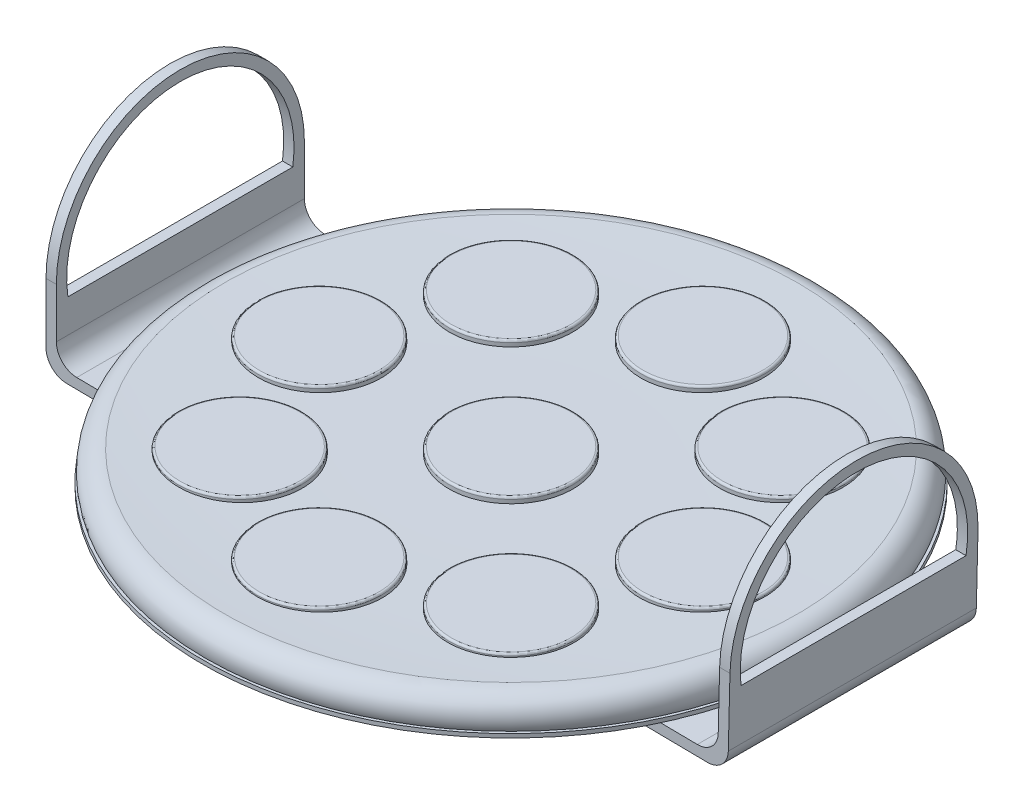
from build123d import *
from build123d.topology import SkipClean

# Parameters (mm, degrees)
BOSS_EXTRUDE2_DEPTH     = 60
SKETCH6_R               = 30
BOSS_EXTRUDE4_DEPTH     = 18
FILLET1_R               = 1
CUT_EXTRUDE3_DEPTH      = 247.307931168
CUT_EXTRUDE3_DEPTH_BACK = 247.307931168


with BuildPart() as part:
    # Sketch1 → Revolve2 (revolve)
    with BuildSketch(Plane(origin=(0, 0, 0), x_dir=(0, 0, -1), z_dir=(1, 0, 0))):
        with BuildLine():
            Line((0, -9.899951667), (84.305935453, -9.899951667))
            add(Edge.make_bspline(
                [(84.305935453, -9.899951667), (106.892937866, -10.544247255), (127.791475348, -3.665461453), (149.217905666, 1.305664828)],
                knots=[0, 0, 0, 0, 1, 1, 1, 1], degree=3))
            Line((149.217905666, 1.305664828), (149.217905666, 3.174221889))
            Line((149.217905666, 3.174221889), (0, 3.174221889))
            Line((0, 3.174221889), (0, -9.899951667))
        make_face()
        with BuildLine():
            add(Edge.make_bspline(
                [(128.668851916, 0), (128.720313422, -3.6975e-05), (128.771761492, 0)],
                knots=[0, 0, 0, 0.004874517, 0.004874517, 0.004874517], degree=2))
            Line((128.771761492, 0), (128.668851916, 0))
        make_face(mode=Mode.SUBTRACT)
    revolve(axis=Axis((0, -32.627772876, 0), (0, 1, 0)))

    # Sketch1<5> → Revolve3 (revolve)
    with BuildSketch(Plane(origin=(0, 0, 0), x_dir=(0, 0, -1), z_dir=(1, 0, 0))):
        with BuildLine():
            Line((0, 15.179487179), (0, 3.174221889))
            Line((0, 3.174221889), (147.880800346, 3.174221889))
            ThreePointArc((147.880800346, 3.174221889), (147.086122142, 12.654308962), (138.717948718, 17.179487179))
            add(Edge.make_bspline(
                [(138.717948718, 17.179487179), (92.524175546, 14.686565586), (46.297561067, 15.179487179), (0, 15.179487179)],
                knots=[0, 0, 0, 0, 1, 1, 1, 1], degree=3))
        make_face()
    revolve(axis=Axis((0, -32.627772876, 0), (0, 1, 0)))

    # Sketch5 → Boss-Extrude2 (add, symmetric)
    with SkipClean():  # the faces are left unmerged after this step: merging them gives an invalid solid
        with BuildSketch(Plane.XY):
            with BuildLine():
                Line((-150.109325594, 1.817178706), (0, 0))
                Line((0, 0), (150.109256671, -1.822863299))
                ThreePointArc((150.109256671, -1.822863299), (157.171926031, 0.977847378), (160.227743781, 7.933942308))
                Line((160.227743781, 7.933942308), (162.36428398, 96.028361832))
                ThreePointArc((162.36428398, 96.028361832), (162.984186831, 97.427956847), (164.412187467, 97.979282463))
                Line((164.412187467, 97.979282463), (165.411893497, 97.955036749))
                ThreePointArc((165.411893497, 97.955036749), (166.811488511, 97.335133897), (167.362814127, 95.907133261))
                Line((167.362814127, 95.907133261), (165.106504032, 2.874328056))
                ThreePointArc((165.106504032, 2.874328056), (162.050686282, -4.081766874), (154.988016921, -6.882477551))
                Line((154.988016921, -6.882477551), (-0.060618741, -4.999632524))
                Line((-0.060618741, -4.999632524), (-155.109325594, -3.122659142))
                ThreePointArc((-155.109325594, -3.122659142), (-162.102013508, -0.151532329), (-164.988277447, 6.876608198))
                Line((-164.988277447, 6.876608198), (-164.988277447, 99.93677035))
                ThreePointArc((-164.988277447, 99.93677035), (-164.40249101, 101.350983912), (-162.988277447, 101.93677035))
                Line((-162.988277447, 101.93677035), (-161.988277447, 101.93677035))
                ThreePointArc((-161.988277447, 101.93677035), (-160.574063885, 101.350983912), (-159.988277447, 99.93677035))
                Line((-159.988277447, 99.93677035), (-159.988277447, 11.816446047))
                ThreePointArc((-159.988277447, 11.816446047), (-157.102013508, 4.78830552), (-150.109325594, 1.817178706))
            make_face()
        extrude(amount=BOSS_EXTRUDE2_DEPTH, both=True)
    add(part.part.scale(1), mode=Mode.REPLACE)  # the faces are merged on a copy

    # Sketch6 → Boss-Extrude4 (add)
    with BuildSketch(Plane(origin=(0, 0, 0), x_dir=(1, 0, 0), z_dir=(0, 1, 0))):
        with Locations(Location((0, 92.837064367, 0), (0, 0, 270))):
            Circle(SKETCH6_R)
        with Locations(Location((0, 0, 0), (0, 0, 90))):
            Circle(SKETCH6_R)
        with Locations(Location((65.645717759, 65.645717759, 0), (0, 0, 90))):
            Circle(SKETCH6_R)
        with Locations(Location((92.837064367, 0, 0), (0, 0, 90))):
            Circle(SKETCH6_R)
        with Locations(Location((65.645717759, -65.645717759, 0), (0, 0, 90))):
            Circle(SKETCH6_R)
        with Locations(Location((0, -92.837064367, 0), (0, 0, 90))):
            Circle(SKETCH6_R)
        with Locations(Location((-65.645717759, -65.645717759, 0), (0, 0, 90))):
            Circle(SKETCH6_R)
        with Locations(Location((-92.837064367, 0, 0), (0, 0, 90))):
            Circle(SKETCH6_R)
        with Locations(Location((-65.645717759, 65.645717759, 0), (0, 0, 90))):
            Circle(SKETCH6_R)
    extrude(amount=BOSS_EXTRUDE4_DEPTH)

    # Fillet1
    fillet1_edges = [part.edges().sort_by_distance(p)[0] for p in [
        (0, 18, 122.837064367),
        (-65.645717759, 18, 95.645717759),
        (-92.837064367, 18, 30),
        (-65.645717759, 18, -35.645717759),
        (0, 18, -122.837064367),
        (0, 18, 30),
        (65.645717759, 18, -35.645717759),
        (92.837064367, 18, 30),
        (65.645717759, 18, 95.645717759),
    ]]
    fillet(fillet1_edges, radius=FILLET1_R)

    # Sketch7 → Cut-Extrude3 (cut, two sides: drawn at the far end of the back side and taken through both)
    with BuildSketch(Plane(origin=(0, 0, 0), x_dir=(0, 0, -1), z_dir=(1, 0, 0)).offset(-CUT_EXTRUDE3_DEPTH_BACK)):
        with BuildLine():
            ThreePointArc((60, 35.907133261), (0, 95.907133261), (-60, 35.907133261))
            Line((-60, 35.907133261), (-60, 101.93677035))
            Line((-60, 101.93677035), (60, 101.93677035))
            Line((60, 101.93677035), (60, 35.907133261))
        make_face()
        with BuildLine():
            ThreePointArc((54.41023838, 27.874328056), (0, 90.907133261), (-54.41023838, 27.874328056))
            Line((-54.41023838, 27.874328056), (54.41023838, 27.874328056))
        make_face()
    extrude(amount=CUT_EXTRUDE3_DEPTH + CUT_EXTRUDE3_DEPTH_BACK, mode=Mode.SUBTRACT)


solid = part.part
